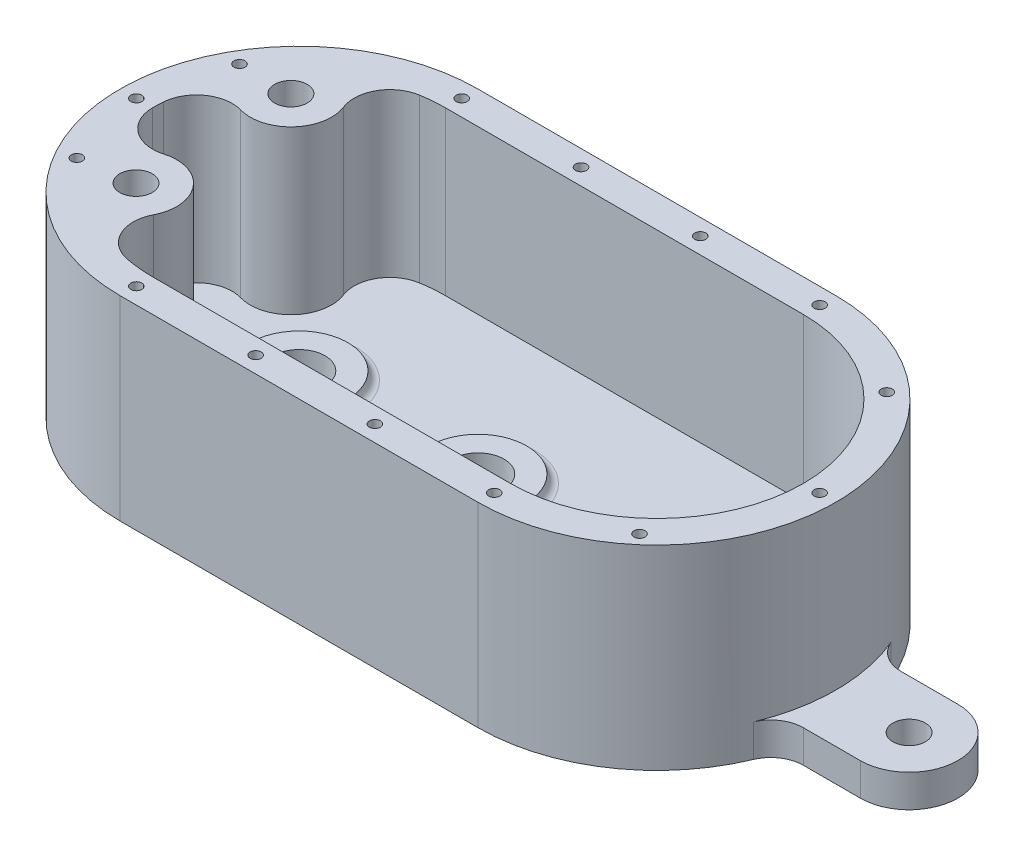
from build123d import *

# Parameters (mm, degrees)
ESBO_O2_R                                      = 30
RESSALTO_EXTRUS_O1_DEPTH                       = 20
ESBO_O2_3_R                                    = 30
ESBO_O2_3_R_2                                  = 16
RESSALTO_EXTRUS_O2_DEPTH                       = 25
FILETE1_R                                      = 5
ESBO_O2_4_R                                    = 10
RESSALTO_EXTRUS_O3_DEPTH                       = 120
ESBO_O2_5_R                                    = 10
RESSALTO_EXTRUS_O4_DEPTH                       = 20
BROCA_DE_ROSQUEAR_PARA_TARRAXA_DE_M8X1_2_D     = 6.8
BROCA_DE_ROSQUEAR_PARA_TARRAXA_DE_M8X1_2_DEPTH = 18.127073895
BROCA_DE_ROSQUEAR_PARA_TARRAXA_DE_M8X1_2_TIP   = 2.042926105
BROCA_DE_ROSQUEAR_PARA_TARRAXA_DE_M1_2X0_D     = 6.8
BROCA_DE_ROSQUEAR_PARA_TARRAXA_DE_M1_2X0_DEPTH = 27.957073895
BROCA_DE_ROSQUEAR_PARA_TARRAXA_DE_M1_2X0_TIP   = 2.042926105


with BuildPart() as part:
    # Esboço2 → Ressalto-extrusão1 (new body)
    with BuildSketch(Plane(origin=(0, 0, 0), x_dir=(1, 0, 0), z_dir=(0, 1, 0))):
        with BuildLine():
            ThreePointArc((-142.766795178, -56.646281478), (-143.009054758, -76.280328146), (-127.472672708, -88.287630552))
            ThreePointArc((-127.472672708, -88.287630552), (-118.778190313, -89.570884638), (-110, -90))
            Line((-110, -90), (110, -90))
            ThreePointArc((110, -90), (200, 0), (110, 90))
            Line((110, 90), (-110, 90))
            ThreePointArc((-110, 90), (-117.443432635, 89.691668011), (-124.835864194, 88.76878468))
            ThreePointArc((-124.835864194, 88.76878468), (-140.336700784, 77.939122352), (-141.707084901, 59.079653418))
            ThreePointArc((-141.707084901, 59.079653418), (-146.501498165, 33.18318015), (-171.82521509, 25.94971021))
            ThreePointArc((-171.82521509, 25.94971021), (-191.746461977, 21.825736054), (-199.769091443, 3.130799391))
            ThreePointArc((-199.769091443, 3.130799391), (-192.469638839, -16.620116582), (-171.914884538, -21.189883063))
            ThreePointArc((-171.914884538, -21.189883063), (-145.688040461, -29.338518263), (-142.766795178, -56.646281478))
        make_face()
        with Locations(Location((-110, 0, 0), (0, 0, 270))):
            Circle(ESBO_O2_R, mode=Mode.SUBTRACT)
        with Locations(Location((0, 0, 0), (0, 0, 270))):
            Circle(ESBO_O2_R, mode=Mode.SUBTRACT)
        with Locations(Location((110, 0, 0), (0, 0, 270))):
            Circle(ESBO_O2_R, mode=Mode.SUBTRACT)
    extrude(amount=RESSALTO_EXTRUS_O1_DEPTH)

    # Esboço2<3> → Ressalto-extrusão2 (add)
    # profile 1 of 3: a face of its own
    with BuildSketch(Plane(origin=(0, 0, 0), x_dir=(1, 0, 0), z_dir=(0, 1, 0))):
        with Locations(Location((-110, 0, 0), (0, 0, 270))):
            Circle(ESBO_O2_3_R)
        with Locations(Location((-110, 0, 0), (0, 0, 270))):
            Circle(ESBO_O2_3_R_2, mode=Mode.SUBTRACT)
    # profile 2 of 3: a face of its own
    with BuildSketch(Plane(origin=(0, 0, 0), x_dir=(1, 0, 0), z_dir=(0, 1, 0))):
        with Locations(Location((0, 0, 0), (0, 0, 270))):
            Circle(ESBO_O2_3_R)
        with Locations(Location((0, 0, 0), (0, 0, 270))):
            Circle(ESBO_O2_3_R_2, mode=Mode.SUBTRACT)
    # profile 3 of 3: a face of its own
    with BuildSketch(Plane(origin=(0, 0, 0), x_dir=(1, 0, 0), z_dir=(0, 1, 0))):
        with Locations(Location((110, 0, 0), (0, 0, 270))):
            Circle(ESBO_O2_3_R)
        with Locations(Location((110, 0, 0), (0, 0, 270))):
            Circle(ESBO_O2_3_R_2, mode=Mode.SUBTRACT)
    extrude(amount=RESSALTO_EXTRUS_O2_DEPTH)

    # Filete1
    filete1_edges = [part.edges().sort_by_distance(p)[0] for p in [
        (0, 20, -30),
        (110, 20, -30),
        (-110, 20, -30),
    ]]
    fillet(filete1_edges, radius=FILETE1_R - 0.0001)  # a hair under: the kernel refuses the full size

    # Esboço2<4> → Ressalto-extrusão3 (add)
    with BuildSketch(Plane(origin=(0, 0, 0), x_dir=(1, 0, 0), z_dir=(0, 1, 0))):
        with BuildLine():
            Line((110, 110), (-110, 110))
            ThreePointArc((-110, 110), (-220, 0), (-110, -110))
            Line((-110, -110), (110, -110))
            ThreePointArc((110, -110), (171.017021585, -91.525532377), (211.538461538, -42.307692308))
            ThreePointArc((211.538461538, -42.307692308), (220, 0), (211.538461538, 42.307692308))
            ThreePointArc((211.538461538, 42.307692308), (171.017021585, 91.525532377), (110, 110))
        make_face()
        with Locations(Location((-165, -45.214544805, 0), (0, 0, 270))):
            Circle(ESBO_O2_4_R, mode=Mode.SUBTRACT)
        with Locations(Location((-165, 50, 0), (0, 0, 270))):
            Circle(ESBO_O2_4_R, mode=Mode.SUBTRACT)
        with BuildLine():
            ThreePointArc((-124.835864194, 88.76878468), (-117.443432635, 89.691668011), (-110, 90))
            Line((-110, 90), (110, 90))
            ThreePointArc((110, 90), (200, 0), (110, -90))
            Line((110, -90), (-110, -90))
            ThreePointArc((-110, -90), (-118.778190313, -89.570884638), (-127.472672708, -88.287630552))
            ThreePointArc((-127.472672708, -88.287630552), (-143.009054758, -76.280328146), (-142.766795178, -56.646281478))
            ThreePointArc((-142.766795178, -56.646281478), (-145.688040461, -29.338518263), (-171.914884538, -21.189883063))
            ThreePointArc((-171.914884538, -21.189883063), (-191.224927441, -17.629444698), (-199.999977409, -0.063768613))
            ThreePointArc((-199.999977409, -0.063768613), (-199.945314351, 3.136945366), (-199.776858723, 6.333690699))
            ThreePointArc((-199.776858723, 6.333690699), (-190.469129565, 22.793450693), (-171.82521509, 25.94971021))
            ThreePointArc((-171.82521509, 25.94971021), (-146.501498165, 33.18318015), (-141.707084901, 59.079653418))
            ThreePointArc((-141.707084901, 59.079653418), (-140.336700784, 77.939122352), (-124.835864194, 88.76878468))
        make_face(mode=Mode.SUBTRACT)
    extrude(amount=RESSALTO_EXTRUS_O3_DEPTH)

    # Esboço2<5> → Ressalto-extrusão4 (add)
    with BuildSketch(Plane(origin=(0, 0, 0), x_dir=(1, 0, 0), z_dir=(0, 1, 0))):
        with BuildLine():
            ThreePointArc((230, 30), (218.905996075, 33.358994113), (211.538461538, 42.307692308))
            ThreePointArc((211.538461538, 42.307692308), (220, 0), (211.538461538, -42.307692308))
            ThreePointArc((211.538461538, -42.307692308), (218.905996075, -33.358994113), (230, -30))
            Line((230, -30), (265, -30))
            ThreePointArc((265, -30), (295, 0), (265, 30))
            Line((265, 30), (230, 30))
        make_face()
        with Locations(Location((265, 0, 0), (0, 0, 270))):
            Circle(ESBO_O2_5_R, mode=Mode.SUBTRACT)
    extrude(amount=RESSALTO_EXTRUS_O4_DEPTH)

    # Broca de rosquear para tarraxa de M8x1.253
    with Locations(Plane(origin=(0, 120, 0), x_dir=(1, 0, 0), z_dir=(0, 1, 0))):
        with Locations((-210, 0), (-196.602540378, 50), (-196.602540378, -50), (-110, 100), (-36.666666667, 100), (36.666666667, 100), (110, 100), (177.00903444, 74.227954999), (210, 0), (176.479948314, -77.188918812), (110, -100), (36.666666667, -100), (-36.666666667, -100), (-110, -100)):
            Hole(BROCA_DE_ROSQUEAR_PARA_TARRAXA_DE_M8X1_2_D / 2, depth=BROCA_DE_ROSQUEAR_PARA_TARRAXA_DE_M8X1_2_DEPTH)
            with Locations((0, 0, -(BROCA_DE_ROSQUEAR_PARA_TARRAXA_DE_M8X1_2_DEPTH + BROCA_DE_ROSQUEAR_PARA_TARRAXA_DE_M8X1_2_TIP / 2))):  # 118° drill point
                Cone(0, BROCA_DE_ROSQUEAR_PARA_TARRAXA_DE_M8X1_2_D / 2, BROCA_DE_ROSQUEAR_PARA_TARRAXA_DE_M8X1_2_TIP, mode=Mode.SUBTRACT)

    # Broca de rosquear para tarraxa de M1.2x0.251
    with Locations(Plane(origin=(0, 120, 0), x_dir=(1, 0, 0), z_dir=(0, 1, 0))):
        with Locations((-196.602540378, 50), (-210, 0), (-196.602540378, -50), (-110, -100), (-110, 100), (-36.666666667, 100), (36.666666667, 100), (-36.666666667, -100), (36.666666667, -100), (110, 100), (177.00903444, 74.227954999), (210, 0), (176.479948314, -77.188918812), (110, -100)):
            Hole(BROCA_DE_ROSQUEAR_PARA_TARRAXA_DE_M1_2X0_D / 2, depth=BROCA_DE_ROSQUEAR_PARA_TARRAXA_DE_M1_2X0_DEPTH)
            with Locations((0, 0, -(BROCA_DE_ROSQUEAR_PARA_TARRAXA_DE_M1_2X0_DEPTH + BROCA_DE_ROSQUEAR_PARA_TARRAXA_DE_M1_2X0_TIP / 2))):  # 118° drill point
                Cone(0, BROCA_DE_ROSQUEAR_PARA_TARRAXA_DE_M1_2X0_D / 2, BROCA_DE_ROSQUEAR_PARA_TARRAXA_DE_M1_2X0_TIP, mode=Mode.SUBTRACT)


solid = part.part
